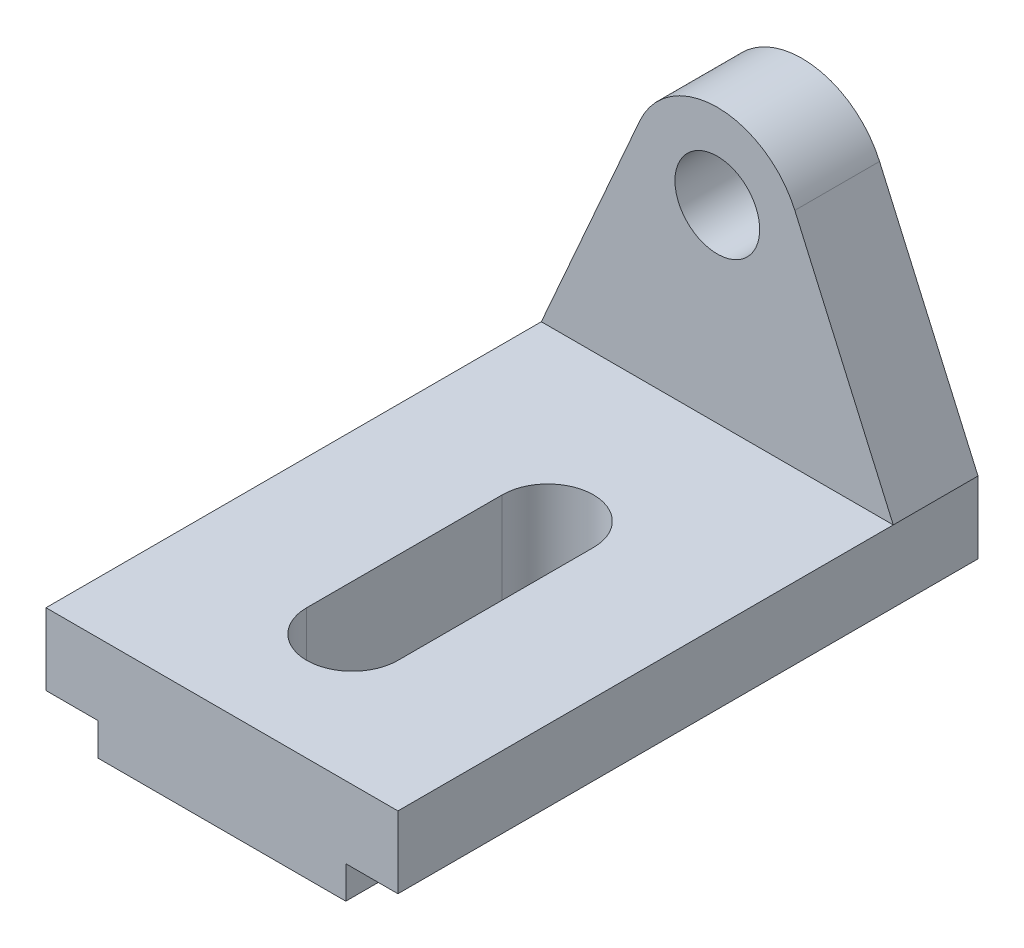
from build123d import *

# Parameters (mm, degrees)
ESBO_O1_W                = 54
ESBO_O1_H                = 16
RESSALTO_EXTRUS_O2_DEPTH = 89
ESBO_O2_W                = 8
ESBO_O2_H                = 4.988802517
CORTE_EXTRUS_O2_DEPTH    = 89
RESSALTO_EXTRUS_O3_DEPTH = 13
CORTE_EXTRUS_O3_DEPTH    = 27


with BuildPart() as part:
    # Esboço1 → Ressalto-extrusão2 (new body)
    with BuildSketch(Plane.XY):
        with Locations((27, -8)):
            Rectangle(ESBO_O1_W, ESBO_O1_H)
    extrude(amount=RESSALTO_EXTRUS_O2_DEPTH)

    # Esboço2 → Corte-extrusão2 (cut)
    with BuildSketch(Plane.XY.offset(89)):
        with Locations((50, -13.505598742)):
            Rectangle(ESBO_O2_W, ESBO_O2_H)
        with Locations((4, -13.505598742)):
            Rectangle(ESBO_O2_W, ESBO_O2_H)
    extrude(amount=-CORTE_EXTRUS_O2_DEPTH, mode=Mode.SUBTRACT)

    # Esboço5 → Ressalto-extrusão3 (add)
    with BuildSketch(Plane(origin=(0, 0, 0), x_dir=(-1, 0, 0), z_dir=(0, 0, -1))):
        with BuildLine():
            Line((-38.894321862, 34.246437596), (-54, 0))
            Line((-54, 0), (-27, 0))
            Line((-27, 0), (0, 0))
            Line((0, 0), (-15.105678138, 34.246437596))
            ThreePointArc((-15.105678138, 34.246437596), (-27, 42), (-38.894321862, 34.246437596))
        make_face()
        with BuildLine():
            ThreePointArc((-20.5, 29), (-22.403805922, 24.403805922), (-27, 22.5))
            ThreePointArc((-27, 22.5), (-31.596194078, 33.596194078), (-20.5, 29))
        make_face(mode=Mode.SUBTRACT)
    extrude(amount=-RESSALTO_EXTRUS_O3_DEPTH)

    # Esboço6 → Corte-extrusão3 (cut)
    with BuildSketch(Plane(origin=(0, 0, 0), x_dir=(1, 0, 0), z_dir=(0, 1, 0))):
        with BuildLine():
            Line((34, -69), (34, -39))
            ThreePointArc((34, -39), (27, -32), (20, -39))
            Line((20, -39), (20, -69))
            ThreePointArc((20, -69), (27, -76), (34, -69))
        make_face()
    extrude(amount=-CORTE_EXTRUS_O3_DEPTH, mode=Mode.SUBTRACT)


solid = part.part
